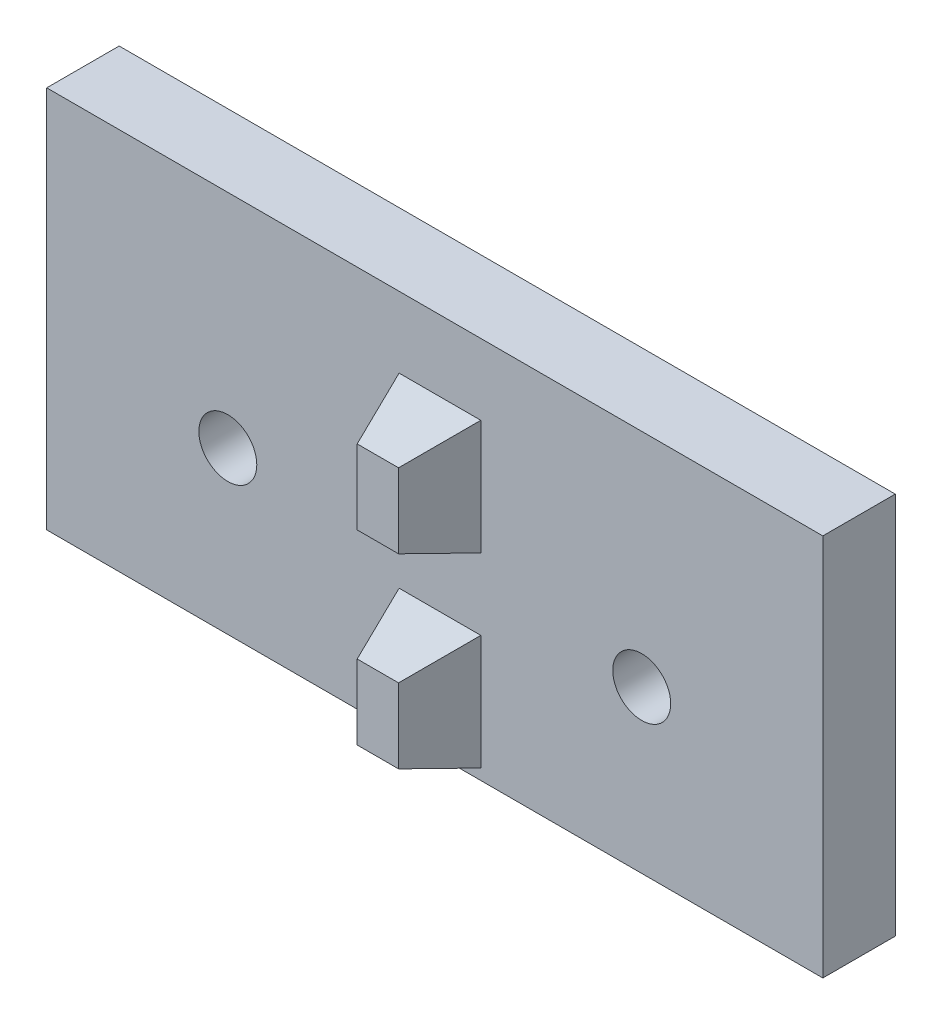
from build123d import *

# Parameters (mm, degrees)
SKETCH_1_W       = 37.5
SKETCH_1_H       = 18.5
SKETCH_1_R       = 1.4
EXTRUDE_1_DEPTH  = 3.5
SKETCH_2_W       = 4
SKETCH_2_H       = 5.6
EXTRUDE_2_DEPTH  = 3
CHAMFER_1_SIZE   = 3.077683537
CHAMFER_1_SIZE_2 = 1


with BuildPart() as part:
    # Эскиз1 → Бобышка-Вытянуть1 (new body)
    with BuildSketch(Plane.XY):
        with Locations((18.75, -9.25)):
            Rectangle(SKETCH_1_W, SKETCH_1_H)
        with Locations((8.75, -10.7)):
            Circle(SKETCH_1_R, mode=Mode.SUBTRACT)
        with Locations((28.75, -10.7)):
            Circle(SKETCH_1_R, mode=Mode.SUBTRACT)
    extrude(amount=EXTRUDE_1_DEPTH)

    # Эскиз2 → Бобышка-Вытянуть2 (add)
    with BuildSketch(Plane.XY.offset(3.5)):
        with Locations((19, -15.2)):
            Rectangle(SKETCH_2_W, SKETCH_2_H)
        with Locations((19, -6.2)):
            Rectangle(SKETCH_2_W, SKETCH_2_H)
    extrude(amount=EXTRUDE_2_DEPTH)

    # Фаска1
    # the kernel refuses this chamfer: 3.077683537, 1 mm, written as the material it takes off along each edge
    with BuildSketch(Plane(origin=(9.012519835, -3.4, 6.5), x_dir=(0, 0.011906840413017355, -0.9999291110630687), z_dir=(1, 0, 0))) as chamfer_1_piece_1_section:
        Polygon((CHAMFER_1_SIZE * 0.99992911112, -CHAMFER_1_SIZE * 0.0119068404137), (-CHAMFER_1_SIZE_2 * 0.011906840413, -CHAMFER_1_SIZE_2 * 0.999929111063), (0, 0), align=None)
    chamfer_1_piece_1 = extrude(amount=19.97496033, mode=Mode.PRIVATE)
    chamfer_1_piece_1 = split(chamfer_1_piece_1, bisect_by=Plane(origin=(19, -3.706604024, 3.5), z_dir=(0, 0, 1)), keep=Keep.TOP, mode=Mode.PRIVATE)
    add(chamfer_1_piece_1, mode=Mode.SUBTRACT)
    with BuildSketch(Plane(origin=(21, 4.587480165, 6.5), x_dir=(0.011906840413017495, 0, -0.9999291110630687), z_dir=(0, -1, 0))) as chamfer_1_piece_2_section:
        Polygon((CHAMFER_1_SIZE * 0.99992911112, -CHAMFER_1_SIZE * 0.0119068404137), (-CHAMFER_1_SIZE_2 * 0.011906840413, -CHAMFER_1_SIZE_2 * 0.999929111063), (0, 0), align=None)
    chamfer_1_piece_2 = extrude(amount=21.57496033, mode=Mode.PRIVATE)
    chamfer_1_piece_2 = split(chamfer_1_piece_2, bisect_by=Plane(origin=(20.693395976, -6.2, 3.5), z_dir=(0, 0, 1)), keep=Keep.TOP, mode=Mode.PRIVATE)
    add(chamfer_1_piece_2, mode=Mode.SUBTRACT)
    with BuildSketch(Plane(origin=(28.987480165, -9, 6.5), x_dir=(0, -0.011906840413017495, -0.9999291110630687), z_dir=(-1, 0, 0))) as chamfer_1_piece_3_section:
        Polygon((CHAMFER_1_SIZE * 0.99992911112, -CHAMFER_1_SIZE * 0.0119068404137), (-CHAMFER_1_SIZE_2 * 0.011906840413, -CHAMFER_1_SIZE_2 * 0.999929111063), (0, 0), align=None)
    chamfer_1_piece_3 = extrude(amount=19.97496033, mode=Mode.PRIVATE)
    chamfer_1_piece_3 = split(chamfer_1_piece_3, bisect_by=Plane(origin=(19, -8.693395976, 3.5), z_dir=(0, 0, 1)), keep=Keep.TOP, mode=Mode.PRIVATE)
    add(chamfer_1_piece_3, mode=Mode.SUBTRACT)
    with BuildSketch(Plane(origin=(17, -16.987480165, 6.5), x_dir=(-0.011906840413017495, 0, -0.9999291110630687), z_dir=(0, 1, 0))) as chamfer_1_piece_4_section:
        Polygon((CHAMFER_1_SIZE * 0.99992911112, -CHAMFER_1_SIZE * 0.0119068404137), (-CHAMFER_1_SIZE_2 * 0.011906840413, -CHAMFER_1_SIZE_2 * 0.999929111063), (0, 0), align=None)
    chamfer_1_piece_4 = extrude(amount=21.57496033, mode=Mode.PRIVATE)
    chamfer_1_piece_4 = split(chamfer_1_piece_4, bisect_by=Plane(origin=(17.306604024, -6.2, 3.5), z_dir=(0, 0, 1)), keep=Keep.TOP, mode=Mode.PRIVATE)
    add(chamfer_1_piece_4, mode=Mode.SUBTRACT)
    with BuildSketch(Plane(origin=(9.012519835, -12.4, 6.5), x_dir=(0, 0.011906840413017495, -0.9999291110630687), z_dir=(1, 0, 0))) as chamfer_1_piece_5_section:
        Polygon((CHAMFER_1_SIZE * 0.99992911112, -CHAMFER_1_SIZE * 0.0119068404137), (-CHAMFER_1_SIZE_2 * 0.011906840413, -CHAMFER_1_SIZE_2 * 0.999929111063), (0, 0), align=None)
    chamfer_1_piece_5 = extrude(amount=19.97496033, mode=Mode.PRIVATE)
    chamfer_1_piece_5 = split(chamfer_1_piece_5, bisect_by=Plane(origin=(19, -12.706604024, 3.5), z_dir=(0, 0, 1)), keep=Keep.TOP, mode=Mode.PRIVATE)
    add(chamfer_1_piece_5, mode=Mode.SUBTRACT)
    with BuildSketch(Plane(origin=(21, -4.412519835, 6.5), x_dir=(0.011906840413017495, 0, -0.9999291110630687), z_dir=(0, -1, 0))) as chamfer_1_piece_6_section:
        Polygon((CHAMFER_1_SIZE * 0.99992911112, -CHAMFER_1_SIZE * 0.0119068404137), (-CHAMFER_1_SIZE_2 * 0.011906840413, -CHAMFER_1_SIZE_2 * 0.999929111063), (0, 0), align=None)
    chamfer_1_piece_6 = extrude(amount=21.57496033, mode=Mode.PRIVATE)
    chamfer_1_piece_6 = split(chamfer_1_piece_6, bisect_by=Plane(origin=(20.693395976, -15.2, 3.5), z_dir=(0, 0, 1)), keep=Keep.TOP, mode=Mode.PRIVATE)
    add(chamfer_1_piece_6, mode=Mode.SUBTRACT)
    with BuildSketch(Plane(origin=(28.987480165, -18, 6.5), x_dir=(0, -0.011906840413017495, -0.9999291110630687), z_dir=(-1, 0, 0))) as chamfer_1_piece_7_section:
        Polygon((CHAMFER_1_SIZE * 0.99992911112, -CHAMFER_1_SIZE * 0.0119068404137), (-CHAMFER_1_SIZE_2 * 0.011906840413, -CHAMFER_1_SIZE_2 * 0.999929111063), (0, 0), align=None)
    chamfer_1_piece_7 = extrude(amount=19.97496033, mode=Mode.PRIVATE)
    chamfer_1_piece_7 = split(chamfer_1_piece_7, bisect_by=Plane(origin=(19, -17.693395976, 3.5), z_dir=(0, 0, 1)), keep=Keep.TOP, mode=Mode.PRIVATE)
    add(chamfer_1_piece_7, mode=Mode.SUBTRACT)
    with BuildSketch(Plane(origin=(17, -25.987480165, 6.5), x_dir=(-0.011906840413017495, 0, -0.9999291110630687), z_dir=(0, 1, 0))) as chamfer_1_piece_8_section:
        Polygon((CHAMFER_1_SIZE * 0.99992911112, -CHAMFER_1_SIZE * 0.0119068404137), (-CHAMFER_1_SIZE_2 * 0.011906840413, -CHAMFER_1_SIZE_2 * 0.999929111063), (0, 0), align=None)
    chamfer_1_piece_8 = extrude(amount=21.57496033, mode=Mode.PRIVATE)
    chamfer_1_piece_8 = split(chamfer_1_piece_8, bisect_by=Plane(origin=(17.306604024, -15.2, 3.5), z_dir=(0, 0, 1)), keep=Keep.TOP, mode=Mode.PRIVATE)
    add(chamfer_1_piece_8, mode=Mode.SUBTRACT)


solid = part.part
